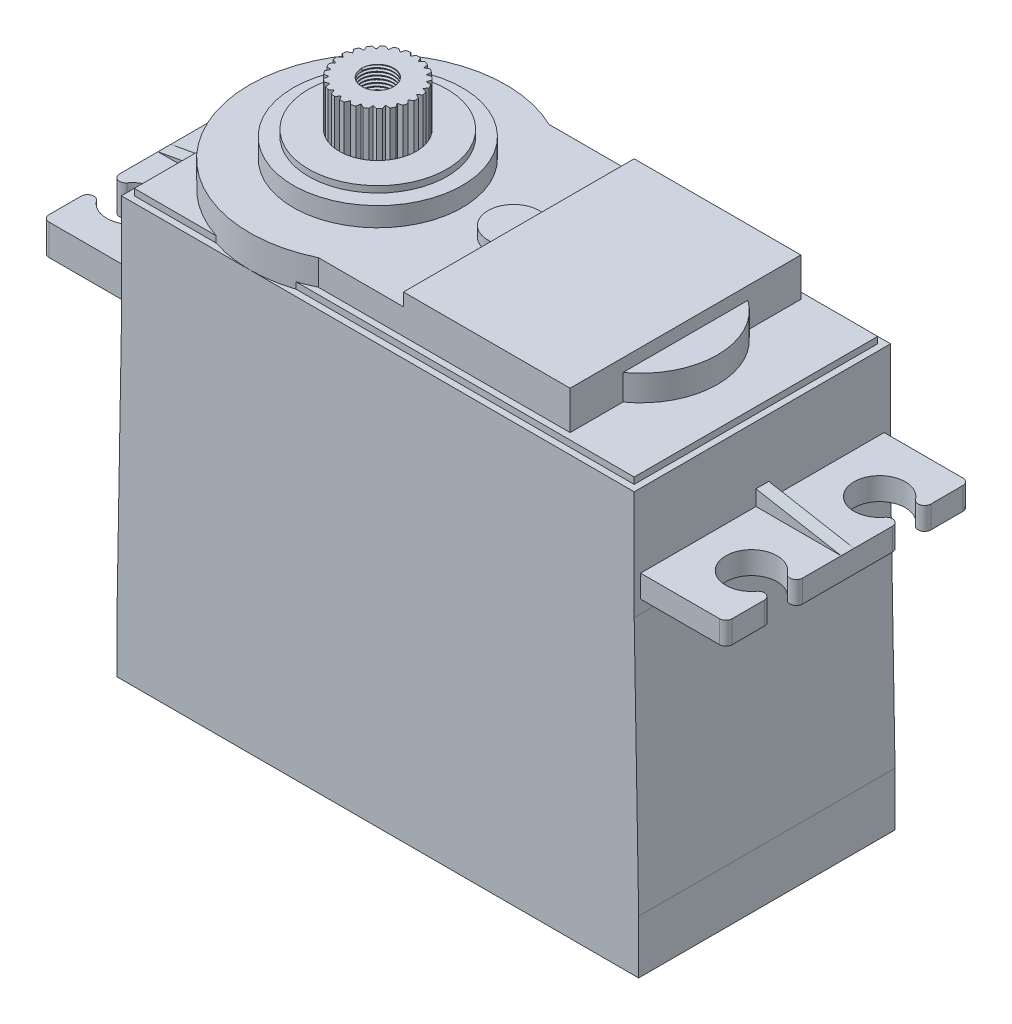
from build123d import *
from build123d.topology import SkipClean

# Parameters (mm, degrees)
SKETCH1_W                                        = 20
SKETCH1_H                                        = 8.5
BODY_1_DEPTH                                     = 10
SKETCH2_W                                        = 39
SKETCH2_H                                        = 19
BOSS_EXTRUDE3_DEPTH                              = 0.5
BOSS_EXTRUDE5_DEPTH                              = 0.5
BOSS_EXTRUDE6_START                              = 2
BOSS_EXTRUDE6_DEPTH                              = 2
SKETCH11_W                                       = 13
SKETCH11_H                                       = 18
BOSS_EXTRUDE7_DEPTH                              = 1
BOSS_EXTRUDE8_DEPTH                              = 0.8
SKETCH13_R                                       = 6.6
BOSS_EXTRUDE9_DEPTH                              = 1.5
SKETCH14_R                                       = 5.4
BOSS_EXTRUDE10_DEPTH                             = 0.5
SKETCH17_R                                       = 3
CUT_EXTRUDE1_DEPTH                               = 12
CHAMFER2_SIZE                                    = 2.82
CBORE_FOR_M2_PAN_HEAD_MACHINE_SCREW1_D           = 2.4
CBORE_FOR_M2_PAN_HEAD_MACHINE_SCREW1_DEPTH       = 8
CBORE_FOR_M2_PAN_HEAD_MACHINE_SCREW1_CBORE_D     = 5
CBORE_FOR_M2_PAN_HEAD_MACHINE_SCREW1_CBORE_DEPTH = 1.6
CBORE_FOR_M2_PAN_HEAD_MACHINE_SCREW1_TIP         = 0.721032743
SKETCH21_R                                       = 3
BOSS_EXTRUDE11_DEPTH                             = 10.5
BOSS_EXTRUDE16_DEPTH                             = 5
SKETCH23_W                                       = 19
SKETCH23_H                                       = 1.753963838
BOSS_EXTRUDE17_DEPTH                             = 6.65
FILLET1_R                                        = 0.5
CUT_EXTRUDE2_DEPTH                               = 7
SKETCH26_W                                       = 1
SKETCH26_H                                       = 1.2
BOSS_EXTRUDE18_DEPTH                             = 6.65
CUT_EXTRUDE3_DEPTH                               = 6.65
BOSS_EXTRUDE19_DEPTH                             = 6.65
CUT_EXTRUDE4_DEPTH                               = 6.65
CUT_EXTRUDE6_DEPTH                               = 6.65
FILLET2_R                                        = 0.5
SKETCH34_R                                       = 1.25
CUT_EXTRUDE7_DEPTH                               = 8
THREAD1_PITCH                                    = 0.25


with BuildPart() as part:
    # Sketch1 → Body 1 (new, symmetric)
    with BuildSketch(Plane.XY):
        Polygon((20.349101299, 26.994041123), (20.349101299, 0), (40.698202597, 0), (40.698202597, 1.994041123), (40.698202597, 6.994041123), (40.349101299, 26.994041123), align=None)
        Polygon((0, 6.994041123), (0, 1.994041123), (0, 0), (20.349101299, 0), (20.349101299, 26.994041123), (0.349101299, 26.994041123), align=None)
        with Locations((10.349101299, 31.244041123)):
            Rectangle(SKETCH1_W, SKETCH1_H)
        with Locations((30.349101299, 31.244041123)):
            Rectangle(SKETCH1_W, SKETCH1_H)
    extrude(amount=BODY_1_DEPTH, both=True)

    # Sketch2 → Boss-Extrude3 (add)
    with BuildSketch(Plane(origin=(0, 35.494041123, 0), x_dir=(1, 0, 0), z_dir=(0, 1, 0))):
        with Locations((20.349101299, 0)):
            Rectangle(SKETCH2_W, SKETCH2_H)
    extrude(amount=BOSS_EXTRUDE3_DEPTH)

    # Sketch3 → Boss-Extrude5 (add)
    with BuildSketch(Plane(origin=(0, 35.994041123, 0), x_dir=(1, 0, 0), z_dir=(0, 1, 0))):
        with BuildLine():
            ThreePointArc((0.849101299, 3.122498999), (0.349101299, 0), (0.849101299, -3.122498999))
            Line((0.849101299, -3.122498999), (0.849101299, 3.122498999))
        make_face()
        with BuildLine():
            ThreePointArc((13.471600298, 9.5), (10.349101299, 10), (7.226602299, 9.5))
            Line((7.226602299, 9.5), (13.471600298, 9.5))
        make_face()
        with BuildLine():
            Line((13.471600298, -9.5), (7.226602299, -9.5))
            ThreePointArc((7.226602299, -9.5), (10.349101299, -10), (13.471600298, -9.5))
        make_face()
    extrude(amount=-BOSS_EXTRUDE5_DEPTH)

    # Sketch8 → Boss-Extrude6 (add)
    with BuildSketch(Plane(origin=(0, 35.994041123, 0), x_dir=(1, 0, 0), z_dir=(0, 1, 0)).offset(BOSS_EXTRUDE6_START)):
        with BuildLine():
            Line((14.708000242, -9), (34.349101299, -9))
            Line((34.349101299, -9), (34.349101299, 9))
            Line((34.349101299, 9), (14.708000242, 9))
            ThreePointArc((14.708000242, 9), (0.349101299, 0), (14.708000242, -9))
        make_face()
        with BuildLine():
            Line((34.349101299, -4.873397172), (34.349101299, 4.873397172))
            ThreePointArc((34.349101299, 4.873397172), (36.849101299, 0), (34.349101299, -4.873397172))
        make_face()
    extrude(amount=-BOSS_EXTRUDE6_DEPTH)

    # Sketch11 → Boss-Extrude7 (add)
    with BuildSketch(Plane(origin=(0, 37.994041123, 0), x_dir=(1, 0, 0), z_dir=(0, 1, 0))):
        with Locations((27.849101299, 0)):
            Rectangle(SKETCH11_W, SKETCH11_H)
    extrude(amount=BOSS_EXTRUDE7_DEPTH)

    # Sketch12 → Boss-Extrude8 (add)
    with BuildSketch(Plane(origin=(0, 37.994041123, 0), x_dir=(1, 0, 0), z_dir=(0, 1, 0))):
        with BuildLine():
            ThreePointArc((21.349101299, 1.959591794), (18.949101299, 0), (21.349101299, -1.959591794))
            Line((21.349101299, -1.959591794), (21.349101299, 0))
            Line((21.349101299, 0), (21.349101299, 1.959591794))
        make_face()
    extrude(amount=BOSS_EXTRUDE8_DEPTH)

    # Sketch13 → Boss-Extrude9 (add)
    with BuildSketch(Plane(origin=(0, 37.994041123, 0), x_dir=(1, 0, 0), z_dir=(0, 1, 0))):
        with Locations(Location((10.349101299, 0, 0), (0, 0, 180))):
            Circle(SKETCH13_R)
    extrude(amount=BOSS_EXTRUDE9_DEPTH)

    # Sketch14 → Boss-Extrude10 (add)
    with BuildSketch(Plane(origin=(0, 39.494041123, 0), x_dir=(1, 0, 0), z_dir=(0, 1, 0))):
        with Locations(Location((10.349101299, 0, 0), (0, 0, 180))):
            Circle(SKETCH14_R)
    extrude(amount=BOSS_EXTRUDE10_DEPTH)

    # Sketch17 → Cut-Extrude1 (cut)
    with BuildSketch(Plane(origin=(0, 39.994041123, 0), x_dir=(1, 0, 0), z_dir=(0, 1, 0))):
        with Locations(Location((10.349101299, 0, 0), (0, 0, 180))):
            Circle(SKETCH17_R)
    extrude(amount=-CUT_EXTRUDE1_DEPTH, mode=Mode.SUBTRACT)

    # Chamfer2
    chamfer2_edges = [part.edges().sort_by_distance(p)[0] for p in [
        (20.349101299, 0, -10),
        (40.698202597, 0, 0),
        (0, 0, 0),
        (20.349101299, 0, 10),
    ]]
    chamfer(chamfer2_edges, length=CHAMFER2_SIZE)

    # CBORE for M2 Pan Head Machine Screw1
    with Locations(Plane(origin=(0, 0, 0), x_dir=(-1, 0, 0), z_dir=(0, -1, 0))):
        with Locations((-38.698202597, 8), (-2, 8), (-2, -8), (-38.698202597, -8)):
            CounterBoreHole(CBORE_FOR_M2_PAN_HEAD_MACHINE_SCREW1_D / 2, CBORE_FOR_M2_PAN_HEAD_MACHINE_SCREW1_CBORE_D / 2, CBORE_FOR_M2_PAN_HEAD_MACHINE_SCREW1_CBORE_DEPTH, depth=CBORE_FOR_M2_PAN_HEAD_MACHINE_SCREW1_DEPTH)
            with Locations((0, 0, -(CBORE_FOR_M2_PAN_HEAD_MACHINE_SCREW1_DEPTH + CBORE_FOR_M2_PAN_HEAD_MACHINE_SCREW1_TIP / 2))):  # 118° drill point
                Cone(0, CBORE_FOR_M2_PAN_HEAD_MACHINE_SCREW1_D / 2, CBORE_FOR_M2_PAN_HEAD_MACHINE_SCREW1_TIP, mode=Mode.SUBTRACT)

    # Sketch23 → Boss-Extrude17 (add)
    with BuildSketch(Plane(origin=(40.349101299, 0, 0), x_dir=(0, 0, -1), z_dir=(1, 0, 0))):
        with Locations((0, 28.871023042)):
            Rectangle(SKETCH23_W, SKETCH23_H)
    extrude(amount=BOSS_EXTRUDE17_DEPTH)

    # Fillet1
    fillet1_edges = [part.edges().sort_by_distance(p)[0] for p in [
        (46.999101299, 28.871023042, 9.5),
        (46.999101299, 28.871023042, -9.5),
    ]]
    fillet(fillet1_edges, radius=FILLET1_R)

    # Sketch25 → Cut-Extrude2 (cut)
    with BuildSketch(Plane(origin=(0, 29.748004961, 0), x_dir=(1, 0, 0), z_dir=(0, 1, 0))):
        with BuildLine():
            Line((46.999101299, 6.5), (46.999101299, 3.5))
            ThreePointArc((46.999101299, 3.5), (46.657215182, 3.974341649), (46.099101299, 3.8))
            ThreePointArc((46.099101299, 3.8), (42.499101299, 5), (46.099101299, 6.2))
            ThreePointArc((46.099101299, 6.2), (46.657215182, 6.025658351), (46.999101299, 6.5))
        make_face()
        with BuildLine():
            Line((46.999101299, -3.5), (46.999101299, -6.5))
            ThreePointArc((46.999101299, -6.5), (46.657215182, -6.025658351), (46.099101299, -6.2))
            ThreePointArc((46.099101299, -6.2), (42.499101299, -5), (46.099101299, -3.8))
            ThreePointArc((46.099101299, -3.8), (46.657215182, -3.974341649), (46.999101299, -3.5))
        make_face()
    extrude(amount=-CUT_EXTRUDE2_DEPTH, mode=Mode.SUBTRACT)

    # Sketch26 → Boss-Extrude18 (add)
    with BuildSketch(Plane(origin=(40.349101299, 0, 0), x_dir=(0, 0, -1), z_dir=(1, 0, 0))):
        with Locations((0, 30.348004961)):
            Rectangle(SKETCH26_W, SKETCH26_H)
    extrude(amount=BOSS_EXTRUDE18_DEPTH)

    # Sketch28 → Cut-Extrude3 (cut)
    with BuildSketch(Plane.XY.offset(0.5)):
        Polygon((40.349101299, 30.948004961), (46.999101299, 29.748004961), (46.999101299, 30.948004961), align=None)
    extrude(amount=-CUT_EXTRUDE3_DEPTH, mode=Mode.SUBTRACT)

    # Sketch29 → Boss-Extrude19 (add)
    with BuildSketch(Plane.ZY.offset(-0.349101299)):
        Polygon((-9.5, 30.394041123), (-0.5, 30.394041123), (-0.5, 31.594041123), (0.5, 31.594041123), (0.5, 30.394041123), (9.5, 30.394041123), (9.5, 27.994041123), (-9.5, 27.994041123), align=None)
    extrude(amount=BOSS_EXTRUDE19_DEPTH)

    # Sketch30 → Cut-Extrude4 (cut)
    with BuildSketch(Plane(origin=(0, 0, -0.5), x_dir=(-1, 0, 0), z_dir=(0, 0, -1))):
        Polygon((-0.349101299, 31.594041123), (6.300898701, 30.394041123), (6.300898701, 31.594041123), align=None)
    extrude(amount=-CUT_EXTRUDE4_DEPTH, mode=Mode.SUBTRACT)

    # Sketch31 → Cut-Extrude6 (cut)
    with BuildSketch(Plane.XZ.offset(-27.994041123)):
        with BuildLine():
            Line((-6.300898701, -6.5), (-6.300898701, -3.5))
            ThreePointArc((-6.300898701, -3.5), (-5.959012584, -3.974341649), (-5.400898701, -3.8))
            ThreePointArc((-5.400898701, -3.8), (-1.800898701, -5), (-5.400898701, -6.2))
            ThreePointArc((-5.400898701, -6.2), (-5.959012584, -6.025658351), (-6.300898701, -6.5))
        make_face()
        with BuildLine():
            Line((-6.300898701, 6.5), (-6.300898701, 3.5))
            ThreePointArc((-6.300898701, 3.5), (-5.959012584, 3.974341649), (-5.400898701, 3.8))
            ThreePointArc((-5.400898701, 3.8), (-1.800898701, 5), (-5.400898701, 6.2))
            ThreePointArc((-5.400898701, 6.2), (-5.959012584, 6.025658351), (-6.300898701, 6.5))
        make_face()
    extrude(amount=-CUT_EXTRUDE6_DEPTH, mode=Mode.SUBTRACT)

    # Fillet2
    fillet2_edges = [part.edges().sort_by_distance(p)[0] for p in [
        (-6.300898701, 29.194041123, -9.5),
        (-6.300898701, 29.194041123, 9.5),
    ]]
    fillet(fillet2_edges, radius=FILLET2_R)


with BuildPart() as body_2:
    # Sketch21 → Boss-Extrude11 (new body)
    with BuildSketch(Plane(origin=(0, 27.994041123, 0), x_dir=(1, 0, 0), z_dir=(0, 1, 0))):
        with Locations((10.349101299, 0)):
            Circle(SKETCH21_R)
    extrude(amount=BOSS_EXTRUDE11_DEPTH)

    # Boss-Extrude16: read off the stored shape, not the designer's step
    # Boss-Extrude16 outline → Boss-Extrude16 (add)
    with BuildSketch(Plane(origin=(0, 38.494041123, 0), x_dir=(1, 0, 0), z_dir=(0, 1, 0))):
        with BuildLine():
            Line((7.35816942, 0.21203453), (7.649101299, 0))
            Line((7.649101299, 0), (7.35816942, -0.21203453))
            ThreePointArc((7.35816942, -0.21203453), (7.374306596, -0.375803966), (7.399404201, -0.538441436))
            Line((7.399404201, -0.538441436), (7.733926764, -0.671462695))
            Line((7.733926764, -0.671462695), (7.504865888, -0.949187587))
            ThreePointArc((7.504865888, -0.949187587), (7.561223887, -1.103798752), (7.6259793, -1.255085146))
            Line((7.6259793, -1.255085146), (7.983073262, -1.30073492))
            Line((7.983073262, -1.30073492), (7.830276128, -1.626699697))
            ThreePointArc((7.830276128, -1.626699697), (7.92331377, -1.762437803), (8.023658168, -1.892867241))
            Line((8.023658168, -1.892867241), (8.380886005, -1.848277186))
            Line((8.380886005, -1.848277186), (8.313953416, -2.202000282))
            ThreePointArc((8.313953416, -2.202000282), (8.437824804, -2.310336406), (8.567453181, -2.411713526))
            Line((8.567453181, -2.411713526), (8.902368952, -2.279685399))
            Line((8.902368952, -2.279685399), (8.925506531, -2.638941091))
            ThreePointArc((8.925506531, -2.638941091), (9.07242837, -2.713068075), (9.223195697, -2.77902298))
            Line((9.223195697, -2.77902298), (9.514755414, -2.567852594))
            Line((9.514755414, -2.567852594), (9.626509341, -2.910067526))
            ThreePointArc((9.626509341, -2.910067526), (9.787249991, -2.945327699), (9.949683004, -2.9717162))
            Line((9.949683004, -2.9717162), (10.179566896, -2.694672167))
            Line((10.179566896, -2.694672167), (10.37291526, -2.998343716))
            ThreePointArc((10.37291526, -2.998343716), (10.537374796, -2.992521551), (10.70126723, -2.977685561))
            Line((10.70126723, -2.977685561), (10.855030848, -2.652175577))
            Line((10.855030848, -2.652175577), (11.117824861, -2.898222943))
            ThreePointArc((11.117824861, -2.898222943), (11.275669685, -2.851684269), (11.430723576, -2.796555988))
            Line((11.430723576, -2.796555988), (11.498705386, -2.443033042))
            Line((11.498705386, -2.443033042), (11.814432734, -2.615996164))
            ThreePointArc((11.814432734, -2.615996164), (11.955744874, -2.531665176), (12.092217616, -2.439708517))
            Line((12.092217616, -2.439708517), (12.070146071, -2.080385755))
            Line((12.070146071, -2.080385755), (12.418968443, -2.169396725))
            ThreePointArc((12.418968443, -2.169396725), (12.534868739, -2.05257225), (12.644185248, -1.929565187))
            Line((12.644185248, -1.929565187), (12.533447183, -1.587020181))
            Line((12.533447183, -1.587020181), (12.893446787, -1.586486111))
            ThreePointArc((12.893446787, -1.586486111), (12.976652797, -1.44450866), (13.051944314, -1.29818018))
            Line((13.051944314, -1.29818018), (12.85949781, -0.993936292))
            Line((12.85949781, -0.993936292), (13.208054547, -0.90389074))
            ThreePointArc((13.208054547, -0.90389074), (13.25333813, -0.745681279), (13.289873813, -0.585225738))
            Line((13.289873813, -0.585225738), (13.027810992, -0.338399731))
            Line((13.027810992, -0.338399731), (13.343023759, -0.164500589))
            ThreePointArc((13.343023759, -0.164500589), (13.347539583, 0), (13.343023759, 0.164500589))
            Line((13.343023759, 0.164500589), (13.027810992, 0.338399731))
            Line((13.027810992, 0.338399731), (13.289873813, 0.585225738))
            ThreePointArc((13.289873813, 0.585225738), (13.25333813, 0.745681279), (13.208054547, 0.90389074))
            Line((13.208054547, 0.90389074), (12.85949781, 0.993936292))
            Line((12.85949781, 0.993936292), (13.051944314, 1.29818018))
            ThreePointArc((13.051944314, 1.29818018), (12.976652797, 1.44450866), (12.893446787, 1.586486111))
            Line((12.893446787, 1.586486111), (12.533447183, 1.587020181))
            Line((12.533447183, 1.587020181), (12.644185248, 1.929565187))
            ThreePointArc((12.644185248, 1.929565187), (12.534868739, 2.05257225), (12.418968443, 2.169396725))
            Line((12.418968443, 2.169396725), (12.070146071, 2.080385755))
            Line((12.070146071, 2.080385755), (12.092217616, 2.439708517))
            ThreePointArc((12.092217616, 2.439708517), (11.955744874, 2.531665176), (11.814432734, 2.615996164))
            Line((11.814432734, 2.615996164), (11.498705386, 2.443033042))
            Line((11.498705386, 2.443033042), (11.430723576, 2.796555988))
            ThreePointArc((11.430723576, 2.796555988), (11.275669685, 2.851684269), (11.117824861, 2.898222943))
            Line((11.117824861, 2.898222943), (10.855030848, 2.652175577))
            Line((10.855030848, 2.652175577), (10.70126723, 2.977685561))
            ThreePointArc((10.70126723, 2.977685561), (10.537374796, 2.992521551), (10.37291526, 2.998343716))
            Line((10.37291526, 2.998343716), (10.179566896, 2.694672167))
            Line((10.179566896, 2.694672167), (9.949683004, 2.9717162))
            ThreePointArc((9.949683004, 2.9717162), (9.787249991, 2.945327699), (9.626509341, 2.910067526))
            Line((9.626509341, 2.910067526), (9.514755414, 2.567852594))
            Line((9.514755414, 2.567852594), (9.223195697, 2.77902298))
            ThreePointArc((9.223195697, 2.77902298), (9.07242837, 2.713068075), (8.925506531, 2.638941091))
            Line((8.925506531, 2.638941091), (8.902368952, 2.279685399))
            Line((8.902368952, 2.279685399), (8.567453181, 2.411713526))
            ThreePointArc((8.567453181, 2.411713526), (8.437824804, 2.310336406), (8.313953416, 2.202000282))
            Line((8.313953416, 2.202000282), (8.380886005, 1.848277186))
            Line((8.380886005, 1.848277186), (8.023658168, 1.892867241))
            ThreePointArc((8.023658168, 1.892867241), (7.92331377, 1.762437803), (7.830276128, 1.626699697))
            Line((7.830276128, 1.626699697), (7.983073262, 1.30073492))
            Line((7.983073262, 1.30073492), (7.6259793, 1.255085146))
            ThreePointArc((7.6259793, 1.255085146), (7.561223887, 1.103798752), (7.504865888, 0.949187587))
            Line((7.504865888, 0.949187587), (7.733926764, 0.671462695))
            Line((7.733926764, 0.671462695), (7.399404201, 0.538441436))
            ThreePointArc((7.399404201, 0.538441436), (7.374306596, 0.375803966), (7.35816942, 0.21203453))
        make_face()
    extrude(amount=BOSS_EXTRUDE16_DEPTH)

    # Sketch34 → Cut-Extrude7 (cut)
    with BuildSketch(Plane(origin=(0, 43.494041123, 0), x_dir=(1, 0, 0), z_dir=(0, 1, 0))):
        with Locations(Location((10.349101299, 0, 0), (0, 0, 270))):
            Circle(SKETCH34_R)
    extrude(amount=-CUT_EXTRUDE7_DEPTH, mode=Mode.SUBTRACT)

    # Thread1: arcs per turn and ends read off the stored shape
    # Thread1: the profile of Thread Profile1 profile screwed along a right-hand helix through 32 turns, 6 arcs to a turn; built about Z, then put on its axis
    with SkipClean():  # the faces are left unmerged after this step: merging them gives an invalid solid
        thread1_z = Axis((0, 0, 0), (0, 0, 1))
        thread1_corners = [(1.2497, 0, -0.000173205), (1.385316469, 0, 0.078125), (1.385316469, 0, 0.109375), (1.2497, 0, 0.187673204)]
        with BuildLine(mode=Mode.PRIVATE) as thread1_profile:
            Line(thread1_corners[0], thread1_corners[1])
            Line(thread1_corners[1], thread1_corners[2])
            Line(thread1_corners[2], thread1_corners[3])
            Line(thread1_corners[3], thread1_corners[0])
        thread1_cap = Face(thread1_profile.wire())
        thread1_turn_angles = [0, 30, 60, 90, 120, 150, 180, 210, 240, 270, 300, 330, 360]
        thread1_turn_weights = [1, 0.8660254037844387, 1, 0.8660254037844387, 1, 0.8660254037844387, 1, 0.8660254037844387, 1, 0.8660254037844387, 1, 0.8660254037844387, 1]
        thread1_turn_rails = [Edge.make_bspline([Vector(p[0], p[1], 0).rotate(thread1_z, thread1_turn_angles[k]) / thread1_turn_weights[k] + Vector(0, 0, p[2] + THREAD1_PITCH * thread1_turn_angles[k] / 360) for k in range(13)], [0, 0, 0, 1, 1, 2, 2, 3, 3, 4, 4, 5, 5, 6, 6, 6], 2, thread1_turn_weights) for p in thread1_corners]
        thread1_turn_sides = [Face.make_surface_from_curves(thread1_turn_rails[p[0]], thread1_turn_rails[p[1]]) for p in [(0, 1), (1, 2), (2, 3), (3, 0)]]
        thread1 = Plane(origin=(10.349101299, 43.494041123, 0), x_dir=(-1, 0, 0), z_dir=(0, -1, 0)) * Solid(Shell([*[p.moved(Location((0, 0, THREAD1_PITCH * i))) for i in range(32) for p in thread1_turn_sides], thread1_cap, thread1_cap.rotate(thread1_z, 11520).moved(Location((0, 0, THREAD1_PITCH * 11520 / 360)))]))
        add(thread1, mode=Mode.SUBTRACT)


solid = Compound([part.part, body_2.part])
